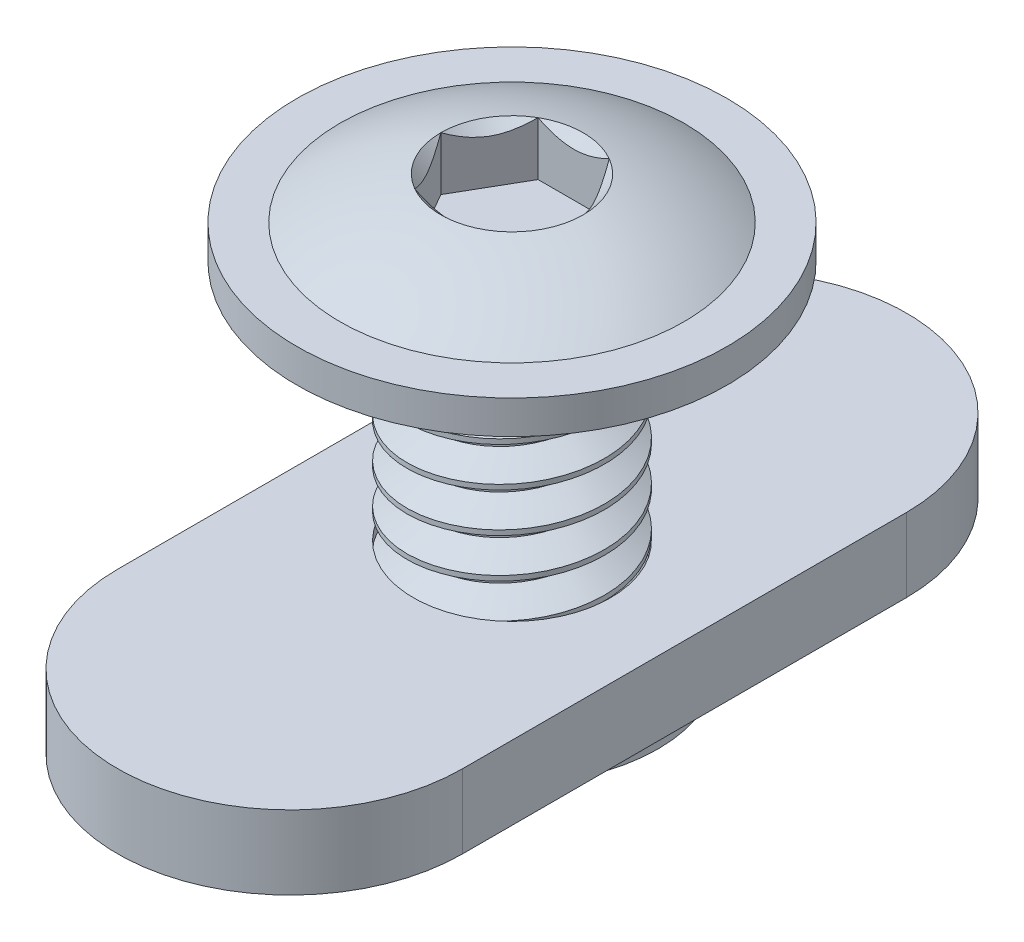
from build123d import *

# Parameters (mm, degrees)
SKETCH2_W                    = 3.175
SKETCH2_H                    = 12.7
CHAMFER1_SIZE                = 1.27
CUT_SWEEP1_PITCH             = 1.27
CUT_EXTRUDE1_DEPTH           = 1.984375
SKETCH7_R                    = 2.291358881
CUT_EXTRUDE2_DEPTH           = 1.726209
CUT_EXTRUDE2_TAPER           = 45
CUT_EXTRUDE2_OTHER_WAY_DEPTH = 19.02385524
SKETCH8_R                    = 3.175
EXTRUDE1_DEPTH               = 1.7272
SKETCH9_R                    = 4.699
CUT_EXTRUDE3_DEPTH           = 1.0795


with BuildPart() as part:
    # Sketch2 → Revolve2 (revolve)
    with BuildSketch(Plane.XY, mode=Mode.PRIVATE) as revolve2_sk:
        with Locations((-1.5875, 6.35)):
            Rectangle(SKETCH2_W, SKETCH2_H)
    revolve(revolve2_sk.sketch.rotate(Axis((0, 0, 0), (0, 1, 0)), 270), axis=Axis((0, 0, 0), (0, 1, 0)))

    # Chamfer1
    chamfer1_edges = [part.edges().sort_by_distance(p)[0] for p in [
        (0, 0, 3.175),
    ]]
    chamfer(chamfer1_edges, length=CHAMFER1_SIZE)

    # Cut-Sweep1: the profile of Sketch4 profile screwed along a right-hand helix of 13.75 turns, 6 arcs to a turn; built about Z, then put on its axis
    cut_sweep1_z = Axis((0, 0, 0), (0, 0, 1))
    cut_sweep1_corners = [(3.1753, 0, -1.111423205), (3.1753, 0, 0.000173205), (2.350110803, 0, -0.47625), (2.350110803, 0, -0.635)]
    with BuildLine(mode=Mode.PRIVATE) as cut_sweep1_profile:
        Line(cut_sweep1_corners[0], cut_sweep1_corners[1])
        Line(cut_sweep1_corners[1], cut_sweep1_corners[2])
        Line(cut_sweep1_corners[2], cut_sweep1_corners[3])
        Line(cut_sweep1_corners[3], cut_sweep1_corners[0])
    cut_sweep1_cap = Face(cut_sweep1_profile.wire())
    cut_sweep1_turn_angles = [0, 30, 60, 90, 120, 150, 180, 210, 240, 270, 300, 330, 360]
    cut_sweep1_turn_weights = [1, 0.8660254037844387, 1, 0.8660254037844387, 1, 0.8660254037844387, 1, 0.8660254037844387, 1, 0.8660254037844387, 1, 0.8660254037844387, 1]
    cut_sweep1_turn_rails = [Edge.make_bspline([Vector(p[0], p[1], 0).rotate(cut_sweep1_z, cut_sweep1_turn_angles[k]) / cut_sweep1_turn_weights[k] + Vector(0, 0, p[2] + CUT_SWEEP1_PITCH * cut_sweep1_turn_angles[k] / 360) for k in range(13)], [0, 0, 0, 1, 1, 2, 2, 3, 3, 4, 4, 5, 5, 6, 6, 6], 2, cut_sweep1_turn_weights) for p in cut_sweep1_corners]
    cut_sweep1_turn_sides = [Face.make_surface_from_curves(cut_sweep1_turn_rails[p[0]], cut_sweep1_turn_rails[p[1]]) for p in [(0, 1), (1, 2), (2, 3), (3, 0)]]
    cut_sweep1_last_angles = [4680, 4710, 4740, 4770, 4800, 4830, 4860, 4890, 4920, 4935, 4950]
    cut_sweep1_last_weights = [1, 0.8660254037844387, 1, 0.8660254037844387, 1, 0.8660254037844387, 1, 0.8660254037844387, 1, 0.9659258262890539, 1]
    cut_sweep1_last_rails = [Edge.make_bspline([Vector(p[0], p[1], 0).rotate(cut_sweep1_z, cut_sweep1_last_angles[k]) / cut_sweep1_last_weights[k] + Vector(0, 0, p[2] + CUT_SWEEP1_PITCH * cut_sweep1_last_angles[k] / 360) for k in range(11)], [0, 0, 0, 1, 1, 2, 2, 3, 3, 4, 4, 5, 5, 5], 2, cut_sweep1_last_weights) for p in cut_sweep1_corners]
    cut_sweep1_last_sides = [Face.make_surface_from_curves(cut_sweep1_last_rails[p[0]], cut_sweep1_last_rails[p[1]]) for p in [(0, 1), (1, 2), (2, 3), (3, 0)]]
    cut_sweep1 = Plane(origin=(0, 12.7, 0), x_dir=(1, 0, 0), z_dir=(0, -1, 0)) * Solid(Shell([*[p.moved(Location((0, 0, CUT_SWEEP1_PITCH * i))) for i in range(13) for p in cut_sweep1_turn_sides], *cut_sweep1_last_sides, cut_sweep1_cap, cut_sweep1_cap.rotate(cut_sweep1_z, 4950).moved(Location((0, 0, CUT_SWEEP1_PITCH * 4950 / 360)))]))
    add(cut_sweep1, mode=Mode.SUBTRACT)

    # Sketch5 → Revolve3 (revolve)
    with BuildSketch(Plane.XY):
        with BuildLine():
            Line((0, 12.7), (0, 15.3924))
            ThreePointArc((0, 15.3924), (-2.884017607, 14.980293811), (-5.5372, 13.77696))
            Line((-5.5372, 13.77696), (-6.9215, 13.77696))
            Line((-6.9215, 13.77696), (-6.9215, 12.7))
            Line((-6.9215, 12.7), (0, 12.7))
        make_face()
    revolve(axis=Axis((0, 0, 0), (0, 1, 0)))

    # Sketch6 → Cut-Extrude1 (cut)
    with BuildSketch(Plane(origin=(0, 15.3924, 0), x_dir=(-1, 0, 0), z_dir=(0, 1, 0))):
        Polygon((1.14567944, 1.984375), (-1.14567944, 1.984375), (-2.291358881, 0), (-1.14567944, -1.984375), (1.14567944, -1.984375), (2.291358881, 0), align=None)
    extrude(amount=-CUT_EXTRUDE1_DEPTH, mode=Mode.SUBTRACT)

    # Sketch7 → Cut-Extrude2 (cut)
    with BuildSketch(Plane(origin=(0, 15.134233625, 0), x_dir=(-1, 0, 0), z_dir=(0, 1, 0))):
        Circle(SKETCH7_R)
    extrude(amount=-CUT_EXTRUDE2_DEPTH, taper=CUT_EXTRUDE2_TAPER, mode=Mode.SUBTRACT)

    # Sketch7 → Cut-Extrude2 other way (cut)
    with BuildSketch(Plane(origin=(0, 15.134233625, 0), x_dir=(-1, 0, 0), z_dir=(0, 1, 0))):
        Circle(SKETCH7_R)
    extrude(amount=CUT_EXTRUDE2_OTHER_WAY_DEPTH, mode=Mode.SUBTRACT)


with BuildPart() as body_2:
    # Sketch8 → Extrude1 (new, symmetric)
    with BuildSketch(Plane.XZ.offset(-3.175)):
        with BuildLine():
            Line((-5.55625, 7.14375), (-5.55625, -7.14375))
            ThreePointArc((-5.55625, -7.14375), (0, -12.7), (5.55625, -7.14375))
            Line((5.55625, -7.14375), (5.55625, 7.14375))
            ThreePointArc((5.55625, 7.14375), (0, 12.7), (-5.55625, 7.14375))
        make_face()
        with Locations(Location((0, 0, 0), (0, 0, 270))):
            Circle(SKETCH8_R, mode=Mode.SUBTRACT)
    extrude(amount=EXTRUDE1_DEPTH, both=True)

    # Sketch9 → Cut-Extrude3 (cut)
    with BuildSketch(Plane.XZ.offset(-1.4478)):
        with BuildLine():
            Line((5.55625, -7.14375), (5.55625, 7.14375))
            ThreePointArc((5.55625, 7.14375), (0, 12.7), (-5.55625, 7.14375))
            Line((-5.55625, 7.14375), (-5.55625, -7.14375))
            ThreePointArc((-5.55625, -7.14375), (0, -12.7), (5.55625, -7.14375))
        make_face()
        with Locations(Location((0, 0, 0), (0, 0, 270))):
            Circle(SKETCH9_R, mode=Mode.SUBTRACT)
    extrude(amount=-CUT_EXTRUDE3_DEPTH, mode=Mode.SUBTRACT)


solid = Compound([part.part, body_2.part])
